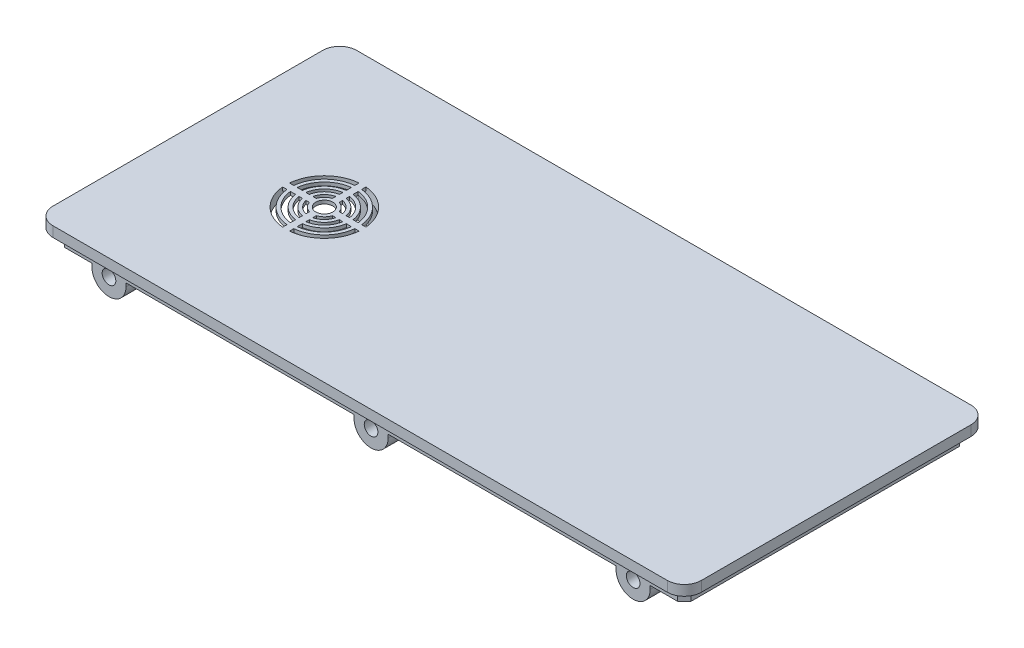
from build123d import *

# Parameters (mm, degrees)
SKETCH1_W                                  = 190
SKETCH1_H                                  = 89
BOSS_EXTRUDE1_DEPTH                        = 3
SKETCH2_W                                  = 183.6
SKETCH2_H                                  = 82.6
SKETCH2_W_2                                = 179.6
SKETCH2_H_2                                = 78.6
BOSS_EXTRUDE2_DEPTH                        = 4
SKETCH3_W                                  = 10
SKETCH3_H                                  = 10
BOSS_EXTRUDE3_DEPTH                        = 6
SKETCH4_R                                  = 2
CUT_EXTRUDE1_DEPTH                         = 4
SKETCH5_W                                  = 10
SKETCH5_H                                  = 10
BOSS_EXTRUDE4_DEPTH                        = 6
SKETCH6_R                                  = 2
CUT_EXTRUDE2_DEPTH                         = 4
MIRROR1_AT_THE_SECOND_PLANE_COPY_1_SKETC_W = 10
MIRROR1_AT_THE_SECOND_PLANE_COPY_1_SKETC_H = 10
MIRROR1_AT_THE_SECOND_PLANE_COPY_1_DEPTH   = 6
MIRROR1_AT_THE_SECOND_PLANE_COPY_2_SKETC_R = 2
MIRROR1_AT_THE_SECOND_PLANE_COPY_2_DEPTH   = 4
FILLET1_R                                  = 5
FILLET3_R                                  = 5
CHAMFER1_SIZE                              = 2
CUT_EXTRUDE3_REACH                         = 107.381
SKETCH7_R                                  = 11.25
BOSS_EXTRUDE5_DEPTH                        = 1
SKETCH9_R                                  = 10
SKETCH9_R_2                                = 9
BOSS_EXTRUDE6_DEPTH                        = 1
SKETCH10_R                                 = 7.5
SKETCH10_R_2                               = 6.5
BOSS_EXTRUDE7_DEPTH                        = 1
SKETCH11_R                                 = 5.5
SKETCH11_R_2                               = 4.5
BOSS_EXTRUDE8_DEPTH                        = 1
SKETCH12_R                                 = 3.5
SKETCH12_R_2                               = 2.5
BOSS_EXTRUDE9_DEPTH                        = 1
CUT_EXTRUDE4_REACH                         = 107.708
SKETCH13_R                                 = 2.5
SKETCH16_W                                 = 7
SKETCH16_H                                 = 7
BOSS_EXTRUDE11_DEPTH                       = 7
SKETCH17_R                                 = 2
CUT_EXTRUDE5_DEPTH                         = 4
BOSS_EXTRUDE12_DEPTH                       = 1.5
FILLET4_R                                  = 2
BOSS_EXTRUDE13_DEPTH                       = 1.5
LPATTERN1_COUNT                            = 2
LPATTERN1_PITCH                            = 76.8
LPATTERN1_COPY_1_DEPTH                     = 1.5
LPATTERN1_COL_COUNT                        = 2
LPATTERN1_COL_PITCH                        = 76.8
LPATTERN1_COL_COPY_1_DEPTH                 = 1.5


with BuildPart() as part:
    # Sketch1 → Boss-Extrude1 (new body)
    with BuildSketch(Plane(origin=(0, 0, 0), x_dir=(1, 0, 0), z_dir=(0, 1, 0))):
        Rectangle(SKETCH1_W, SKETCH1_H)
    extrude(amount=BOSS_EXTRUDE1_DEPTH)

    # Sketch2 → Boss-Extrude2 (add)
    with BuildSketch(Plane.XZ):
        Rectangle(SKETCH2_W, SKETCH2_H)
        Rectangle(SKETCH2_W_2, SKETCH2_H_2, mode=Mode.SUBTRACT)
    extrude(amount=BOSS_EXTRUDE2_DEPTH)

    # Sketch3 → Boss-Extrude3 (add)
    with BuildSketch(Plane(origin=(0, 0, -41.3), x_dir=(-1, 0, 0), z_dir=(0, 0, -1))):
        with Locations((-76.8, -5)):
            Rectangle(SKETCH3_W, SKETCH3_H)
    boss_extrude3 = extrude(amount=-BOSS_EXTRUDE3_DEPTH)

    # Sketch4 → Cut-Extrude1 (cut)
    with BuildSketch(Plane(origin=(0, 0, -41.3), x_dir=(-1, 0, 0), z_dir=(0, 0, -1))):
        with Locations((-76.8, -5)):
            Circle(SKETCH4_R)
    cut_extrude1 = extrude(amount=-CUT_EXTRUDE1_DEPTH, mode=Mode.SUBTRACT)

    # Sketch5 → Boss-Extrude4 (add)
    with BuildSketch(Plane(origin=(0, 0, -41.3), x_dir=(-1, 0, 0), z_dir=(0, 0, -1))):
        with Locations((0, -5)):
            Rectangle(SKETCH5_W, SKETCH5_H)
    boss_extrude4 = extrude(amount=-BOSS_EXTRUDE4_DEPTH)

    # Sketch6 → Cut-Extrude2 (cut)
    with BuildSketch(Plane(origin=(0, 0, -41.3), x_dir=(-1, 0, 0), z_dir=(0, 0, -1))):
        with Locations((0, -5)):
            Circle(SKETCH6_R)
    cut_extrude2 = extrude(amount=-CUT_EXTRUDE2_DEPTH, mode=Mode.SUBTRACT)

    # Mirror1: Boss-Extrude3, Cut-Extrude1 across plane
    add(boss_extrude3.mirror(Plane(origin=(0, 0, 0), x_dir=(0, 0, 1), z_dir=(1, 0, 0))))
    add(cut_extrude1.mirror(Plane(origin=(0, 0, 0), x_dir=(0, 0, 1), z_dir=(1, 0, 0))), mode=Mode.SUBTRACT)

    # Mirror1 at the second plane: Boss-Extrude3, Cut-Extrude1 across plane
    add(boss_extrude3.mirror(Plane.XY))
    add(cut_extrude1.mirror(Plane.XY), mode=Mode.SUBTRACT)

    # Mirror1 at the second plane copy 1 sketc → Mirror1 at the second plane copy 1 (add)
    with BuildSketch(Plane.XY.offset(41.3)):
        with Locations((-76.8, -5)):
            Rectangle(MIRROR1_AT_THE_SECOND_PLANE_COPY_1_SKETC_W, MIRROR1_AT_THE_SECOND_PLANE_COPY_1_SKETC_H)
    extrude(amount=-MIRROR1_AT_THE_SECOND_PLANE_COPY_1_DEPTH)

    # Mirror1 at the second plane copy 2 sketc → Mirror1 at the second plane copy 2 (cut)
    with BuildSketch(Plane.XY.offset(41.3)):
        with Locations((-76.8, -5)):
            Circle(MIRROR1_AT_THE_SECOND_PLANE_COPY_2_SKETC_R)
    extrude(amount=-MIRROR1_AT_THE_SECOND_PLANE_COPY_2_DEPTH, mode=Mode.SUBTRACT)

    # Mirror2: Boss-Extrude4, Cut-Extrude2 across plane
    add(boss_extrude4.mirror(Plane.XY))
    add(cut_extrude2.mirror(Plane.XY), mode=Mode.SUBTRACT)

    # Fillet1
    fillet1_edges = [part.edges().sort_by_distance(p)[0] for p in [
        (81.8, -10, 38.3),
        (71.8, -10, 38.3),
        (-81.8, -10, -38.3),
        (-71.8, -10, -38.3),
        (-81.8, -10, 38.3),
        (-71.8, -10, 38.3),
        (5, -10, 38.3),
        (-5, -10, 38.3),
        (81.8, -10, -38.3),
        (71.8, -10, -38.3),
        (5, -10, -38.3),
        (-5, -10, -38.3),
    ]]
    fillet(fillet1_edges, radius=FILLET1_R - 0.0001)  # a hair under: the kernel refuses the full size

    # Fillet3
    fillet3_edges = [part.edges().sort_by_distance(p)[0] for p in [
        (95, 1.5, 44.5),
        (-95, 1.5, 44.5),
        (-95, 1.5, -44.5),
        (95, 1.5, -44.5),
    ]]
    fillet(fillet3_edges, radius=FILLET3_R)

    # Chamfer1
    chamfer1_edges = [part.edges().sort_by_distance(p)[0] for p in [
        (91.8, -2, 41.3),
        (-91.8, -2, 41.3),
        (-91.8, -2, -41.3),
        (91.8, -2, -41.3),
    ]]
    chamfer(chamfer1_edges, length=CHAMFER1_SIZE)

    # Sketch7 → Cut-Extrude3 (cut, up to next)
    with BuildSketch(Plane.XZ, mode=Mode.PRIVATE) as cut_extrude3_sk1:
        with Locations(Location((-55, 0, 0), (0, 0, 270))):
            Circle(SKETCH7_R)
    cut_extrude3_tool1 = extrude(cut_extrude3_sk1.sketch, amount=-CUT_EXTRUDE3_REACH, mode=Mode.PRIVATE) & part.part
    add(cut_extrude3_tool1.solids().sort_by_distance((-55, 0, 0))[0], mode=Mode.SUBTRACT)

    # Sketch8 → Boss-Extrude5 (add)
    with BuildSketch(Plane(origin=(0, 3, 0), x_dir=(1, 0, 0), z_dir=(0, 1, 0))):
        Polygon((-54, -1), (-54, -15), (-56, -15), (-56, -1), (-70, -1), (-70, 1), (-56, 1), (-56, 15), (-54, 15), (-54, 1), (-40, 1), (-40, -1), align=None)
    extrude(amount=-BOSS_EXTRUDE5_DEPTH)

    # Sketch9 → Boss-Extrude6 (add)
    with BuildSketch(Plane(origin=(0, 3, 0), x_dir=(1, 0, 0), z_dir=(0, 1, 0))):
        with Locations((-55, 0)):
            Circle(SKETCH9_R)
        with Locations((-55, 0)):
            Circle(SKETCH9_R_2, mode=Mode.SUBTRACT)
    extrude(amount=-BOSS_EXTRUDE6_DEPTH)

    # Sketch10 → Boss-Extrude7 (add)
    with BuildSketch(Plane(origin=(0, 3, 0), x_dir=(1, 0, 0), z_dir=(0, 1, 0))):
        with Locations((-55, 0)):
            Circle(SKETCH10_R)
        with Locations((-55, 0)):
            Circle(SKETCH10_R_2, mode=Mode.SUBTRACT)
    extrude(amount=-BOSS_EXTRUDE7_DEPTH)

    # Sketch11 → Boss-Extrude8 (add)
    with BuildSketch(Plane(origin=(0, 3, 0), x_dir=(1, 0, 0), z_dir=(0, 1, 0))):
        with Locations((-55, 0)):
            Circle(SKETCH11_R)
        with Locations((-55, 0)):
            Circle(SKETCH11_R_2, mode=Mode.SUBTRACT)
    extrude(amount=-BOSS_EXTRUDE8_DEPTH)

    # Sketch12 → Boss-Extrude9 (add)
    with BuildSketch(Plane(origin=(0, 3, 0), x_dir=(1, 0, 0), z_dir=(0, 1, 0))):
        with Locations((-55, 0)):
            Circle(SKETCH12_R)
        with Locations((-55, 0)):
            Circle(SKETCH12_R_2, mode=Mode.SUBTRACT)
    extrude(amount=-BOSS_EXTRUDE9_DEPTH)

    # Sketch13 → Cut-Extrude4 (cut, up to next)
    with BuildSketch(Plane(origin=(0, 3, 0), x_dir=(1, 0, 0), z_dir=(0, 1, 0)), mode=Mode.PRIVATE) as cut_extrude4_sk1:
        with Locations(Location((-55, 0, 0), (0, 0, 270))):
            Circle(SKETCH13_R)
    cut_extrude4_tool1 = extrude(cut_extrude4_sk1.sketch, amount=-CUT_EXTRUDE4_REACH, mode=Mode.PRIVATE) & part.part
    add(cut_extrude4_tool1.solids().sort_by_distance((-55, 3, 0))[0], mode=Mode.SUBTRACT)

    # Sketch16 → Boss-Extrude11 (add)
    with BuildSketch(Plane.XZ):
        with Locations((-55, -15)):
            Rectangle(SKETCH16_W, SKETCH16_H)
        with Locations((-55, 15)):
            Rectangle(SKETCH16_W, SKETCH16_H)
    extrude(amount=BOSS_EXTRUDE11_DEPTH)

    # Sketch17 → Cut-Extrude5 (cut)
    with BuildSketch(Plane.XZ.offset(7)):
        with Locations(Location((-55, -15, 0), (0, 0, 270))):
            Circle(SKETCH17_R)
    cut_extrude5 = extrude(amount=-CUT_EXTRUDE5_DEPTH, mode=Mode.SUBTRACT)

    # Mirror3: Cut-Extrude5 across plane
    add(cut_extrude5.mirror(Plane.XY), mode=Mode.SUBTRACT)

    # Sketch19 → Boss-Extrude12 (add, symmetric)
    with BuildSketch(Plane(origin=(-55, 0, 0), x_dir=(0, 0, -1), z_dir=(1, 0, 0))):
        Polygon((18.5, -7), (22.5, 0), (18.5, 0), align=None)
    boss_extrude12 = extrude(amount=BOSS_EXTRUDE12_DEPTH, both=True)

    # Fillet4
    fillet4_edges = [part.edges().sort_by_distance(p)[0] for p in [
        (-58.5, -3.5, -11.5),
        (-51.5, -3.5, -11.5),
        (-51.5, -3.5, -18.5),
        (-58.5, -3.5, -18.5),
        (-58.5, -3.5, 18.5),
        (-51.5, -3.5, 18.5),
        (-51.5, -3.5, 11.5),
        (-58.5, -3.5, 11.5),
    ]]
    fillet(fillet4_edges, radius=FILLET4_R - 0.0001)  # a hair under: the kernel refuses the full size

    # Mirror4: Boss-Extrude12 across plane
    add(boss_extrude12.mirror(Plane.XY))

    # Sketch20 → Boss-Extrude13 (add, symmetric)
    with BuildSketch(Plane.ZY):
        Polygon((-35.3, -10), (-30.3, 0), (-35.3, 0), align=None)
    boss_extrude13 = extrude(amount=BOSS_EXTRUDE13_DEPTH, both=True)

    # Mirror5: Boss-Extrude13 across plane
    add(boss_extrude13.mirror(Plane.XY))

    # LPattern1: Boss-Extrude13 ×2
    with Locations(*[(-i * LPATTERN1_PITCH, 0, 0) for i in range(1, LPATTERN1_COUNT)]):
        add(boss_extrude13)

    # LPattern1 copy 1 sketch → LPattern1 copy 1 (add, symmetric)
    with BuildSketch(Plane(origin=(-76.8, 0, 0), x_dir=(0, 0, -1), z_dir=(-1, 0, 0))):
        Polygon((-35.3, 10), (-30.3, 0), (-35.3, 0), align=None)
    extrude(amount=LPATTERN1_COPY_1_DEPTH, both=True)

    # LPattern1 col: Boss-Extrude13 ×2
    with Locations(*[(i * LPATTERN1_COL_PITCH, 0, 0) for i in range(1, LPATTERN1_COL_COUNT)]):
        add(boss_extrude13)

    # LPattern1 col copy 1 sketch → LPattern1 col copy 1 (add, symmetric)
    with BuildSketch(Plane(origin=(76.8, 0, 0), x_dir=(0, 0, -1), z_dir=(-1, 0, 0))):
        Polygon((-35.3, 10), (-30.3, 0), (-35.3, 0), align=None)
    extrude(amount=LPATTERN1_COL_COPY_1_DEPTH, both=True)


solid = part.part
